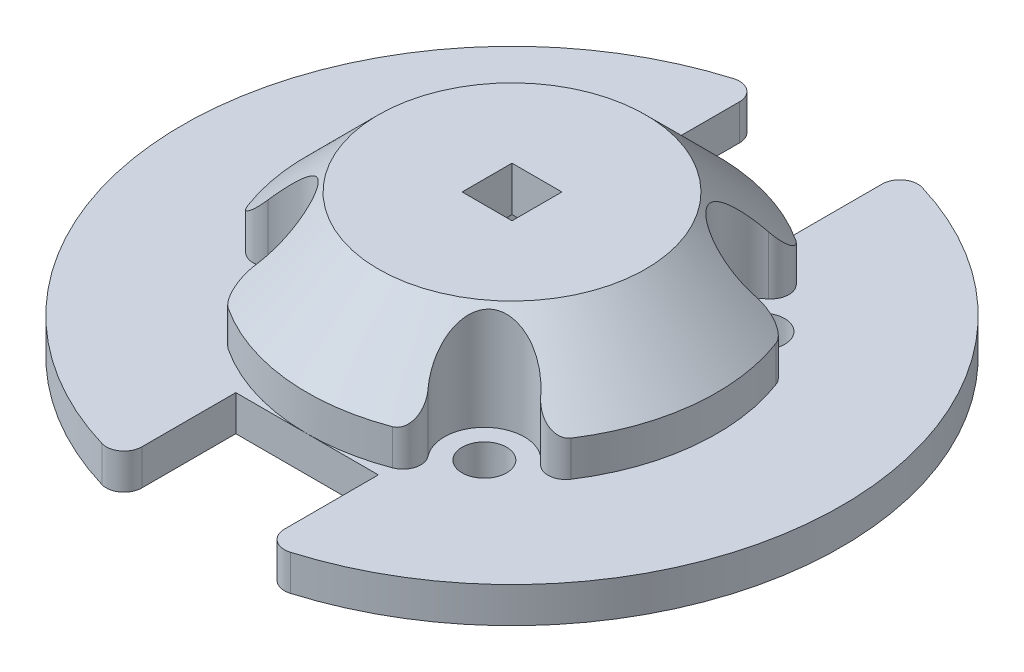
from build123d import *

# Parameters (mm, degrees)
SKETCH1_R             = 12.5
BOSS_EXTRUDE1_DEPTH   = 2
SKETCH2_R             = 11.5
BOSS_EXTRUDE2_DEPTH   = 6
F_2_5MM_DOWEL_HOLE1_D = 2.5
SKETCH7_R             = 2.25
CUT_EXTRUDE1_DEPTH    = 15
CIRPATTERN1_COUNT     = 4
SKETCH8_R             = 7.7
CUT_EXTRUDE2_DEPTH    = 3.5
CHAMFER4_SIZE         = 4
SKETCH3_W             = 2.8
SKETCH3_H             = 2.8
CUT_EXTRUDE3_DEPTH    = 20.403607912
SKETCH9_R             = 5
CUT_EXTRUDE4_DEPTH    = 2
FILLET1_R             = 1
SKETCH11_W            = 6
SKETCH11_H            = 2
SKETCH13_W            = 8
SKETCH13_H            = 10.327587527
CUT_EXTRUDE5_DEPTH    = 10
FILLET2_R             = 1


with BuildPart() as part:
    # Sketch1 → Boss-Extrude1 (new body)
    with BuildSketch(Plane(origin=(0, 0, 0), x_dir=(1, 0, 0), z_dir=(0, 1, 0))):
        with Locations(Location((0, 0, 0), (0, 0, 270))):
            Circle(SKETCH1_R)
    extrude(amount=BOSS_EXTRUDE1_DEPTH)

    # Sketch2 → Boss-Extrude2 (add)
    with BuildSketch(Plane(origin=(0, 2, 0), x_dir=(1, 0, 0), z_dir=(0, 1, 0))):
        with Locations(Location((0, 0, 0), (0, 0, 270))):
            Circle(SKETCH2_R)
    extrude(amount=BOSS_EXTRUDE2_DEPTH)

    # Ø2.5mm Dowel Hole1 (through all)
    with Locations(Plane(origin=(0, 0, 0), x_dir=(-1, 0, 0), z_dir=(0, -1, 0))):
        with Locations((-6.252229289, -7.804462116)):
            f_2_5mm_dowel_hole1 = Hole(F_2_5MM_DOWEL_HOLE1_D / 2)

    # Sketch7 → Cut-Extrude1 (cut)
    with BuildSketch(Plane(origin=(0, 2, 0), x_dir=(1, 0, 0), z_dir=(0, 1, 0))):
        with Locations((6.252229289, -7.804462116)):
            Circle(SKETCH7_R)
    cut_extrude1 = extrude(amount=CUT_EXTRUDE1_DEPTH, mode=Mode.SUBTRACT)

    # CirPattern1: Ø2.5mm Dowel Hole1, Cut-Extrude1 ×4 about axis
    cirpattern1_axis = Axis((0, 0, 0), (0, 1, 0))
    add([f_2_5mm_dowel_hole1.rotate(cirpattern1_axis, i * 360 / CIRPATTERN1_COUNT) for i in range(1, CIRPATTERN1_COUNT)], mode=Mode.SUBTRACT)
    add([cut_extrude1.rotate(cirpattern1_axis, i * 360 / CIRPATTERN1_COUNT) for i in range(1, CIRPATTERN1_COUNT)], mode=Mode.SUBTRACT)

    # Sketch8 → Cut-Extrude2 (cut)
    with BuildSketch(Plane.XZ):
        with Locations(Location((0, 0, 0), (0, 0, 270))):
            Circle(SKETCH8_R)
    extrude(amount=-CUT_EXTRUDE2_DEPTH, mode=Mode.SUBTRACT)

    # Chamfer4
    # the kernel refuses this chamfer: 4 mm, written as the material it takes off along each edge
    with BuildSketch(Plane(origin=(0, 8, 0), x_dir=(-0.15654942512802536, 0, 0.9876701258477371), z_dir=(0.9876701258477371, 0, 0.15654942512802536))) as chamfer4_piece_1:
        Polygon((11.5, CHAMFER4_SIZE), (11.5 - CHAMFER4_SIZE, 0), (11.5, 0), align=None)
    revolve(axis=Axis((0, 8, 0), (0, -1, 0)), revolution_arc=174.589558781, mode=Mode.SUBTRACT)
    with BuildSketch(Plane(origin=(0, 8, 0), x_dir=(0.9876701258477374, 0, 0.15654942512802353), z_dir=(0.15654942512802353, 0, -0.9876701258477374))) as chamfer4_piece_2:
        Polygon((11.5, CHAMFER4_SIZE), (11.5 - CHAMFER4_SIZE, 0), (11.5, 0), align=None)
    revolve(axis=Axis((0, 8, 0), (0, -1, 0)), revolution_arc=174.589558781, mode=Mode.SUBTRACT)
    with BuildSketch(Plane(origin=(0, 8, 0), x_dir=(-0.9876701258477374, 0, -0.15654942512802342), z_dir=(-0.15654942512802342, 0, 0.9876701258477374))) as chamfer4_piece_3:
        Polygon((11.5, CHAMFER4_SIZE), (11.5 - CHAMFER4_SIZE, 0), (11.5, 0), align=None)
    revolve(axis=Axis((0, 8, 0), (0, -1, 0)), revolution_arc=174.589558781, mode=Mode.SUBTRACT)
    with BuildSketch(Plane(origin=(0, 8, 0), x_dir=(0.15654942512802555, 0, -0.987670125847737), z_dir=(-0.987670125847737, 0, -0.15654942512802555))) as chamfer4_piece_4:
        Polygon((11.5, CHAMFER4_SIZE), (11.5 - CHAMFER4_SIZE, 0), (11.5, 0), align=None)
    revolve(axis=Axis((0, 8, 0), (0, -1, 0)), revolution_arc=174.589558781, mode=Mode.SUBTRACT)

    # Sketch3 → Cut-Extrude3 (cut, through all)
    with BuildSketch(Plane(origin=(0, 8, 0), x_dir=(1, 0, 0), z_dir=(0, 1, 0))):
        Rectangle(SKETCH3_W, SKETCH3_H)
    extrude(amount=-CUT_EXTRUDE3_DEPTH, mode=Mode.SUBTRACT)

    # Sketch9 → Cut-Extrude4 (cut)
    with BuildSketch(Plane.XZ.offset(-3.5)):
        with Locations(Location((0, 0, 0), (0, 0, 270))):
            Circle(SKETCH9_R)
    extrude(amount=-CUT_EXTRUDE4_DEPTH, mode=Mode.SUBTRACT)

    # Fillet1
    # the kernel refuses this fillet: 1 mm, written as the material it takes off along each edge
    with BuildSketch(Plane(origin=(-7.744399955, 8.541870217, 8.501427488), x_dir=(0.7901380360957252, 0, 0.6129289387154032), z_dir=(0, -1, 0)), Plane(origin=(-8.501427488, 8.541870217, -7.744399955), x_dir=(-0.6129289387154034, 0, 0.790138036095725), z_dir=(0, -1, 0)), Plane(origin=(8.501427488, 8.541870217, 7.744399955), x_dir=(0.6129289387154006, 0, -0.7901380360957272), z_dir=(0, -1, 0))) as fillet1_piece_1:
        with BuildLine():
            CenterArc((1.73775904, -0.996875484), FILLET1_R, 85.469541484, 107.754858312)
            ThreePointArc((0.76427747, -1.225640938), (0.48316298, -0.549824406), (0, 0))
            ThreePointArc((0, 0), (0.908374043, 0.035931935), (1.816748087, 0))
        make_face()
    extrude(amount=6.541870217, mode=Mode.SUBTRACT)
    with BuildSketch(Plane(origin=(-9.986362414, 8.541870217, 5.702855929), x_dir=(0.5425108766100752, 0, -0.840048777607448), z_dir=(0, -1, 0)), Plane(origin=(-5.702855929, 8.541870217, -9.986362414), x_dir=(0.8400487776074425, 0, 0.5425108766100841), z_dir=(0, -1, 0)), Plane(origin=(9.986362414, 8.541870217, -5.702855929), x_dir=(-0.5425108766100888, 0, 0.8400487776074392), z_dir=(0, -1, 0)), Plane(origin=(5.702855929, 8.541870217, 9.986362414), x_dir=(-0.8400487776074446, 0, -0.5425108766100806), z_dir=(0, -1, 0))) as fillet1_piece_2:
        with BuildLine():
            CenterArc((1.765388102, -0.94708609), FILLET1_R, 108.722180598, 107.754858312)
            ThreePointArc((0.961292932, -1.541586686), (0.450156717, -0.789805949), (0, 0))
            ThreePointArc((0, 0), (0.722204223, -0.119056298), (1.444408447, 0))
        make_face()
    extrude(amount=6.541870217, mode=Mode.SUBTRACT)
    with BuildSketch(Plane(origin=(7.744399955, 8.541870217, -8.501427488), x_dir=(-0.9381802645731545, 0, 0.34614706580505045), z_dir=(0, -1, 0))) as fillet1_piece_3:
        with BuildLine():
            CenterArc((1.765388102, 0.94708609), FILLET1_R, 143.52296109, 107.754858312)
            ThreePointArc((0.961292932, 1.541586686), (0.450156717, 0.789805949), (0, 0))
            ThreePointArc((0, 0), (0.722204223, 0.119056298), (1.444408447, 0))
        make_face()
    extrude(amount=6.541870217, mode=Mode.SUBTRACT)

    # Sketch11 → Revolve1 (revolve)
    with BuildSketch(Plane(origin=(0, 0, 0), x_dir=(0, 0, -1), z_dir=(1, 0, 0)), mode=Mode.PRIVATE) as revolve1_sk:
        with Locations((15.5, 1)):
            Rectangle(SKETCH11_W, SKETCH11_H)
    revolve(revolve1_sk.sketch.rotate(Axis((0, 0, 0), (0, 1, 0)), 20.668231864), axis=Axis((0, 0, 0), (0, 1, 0)))

    # Sketch13 → Cut-Extrude5 (cut)
    with BuildSketch(Plane(origin=(0, 2, 0), x_dir=(1, 0, 0), z_dir=(0, 1, 0))):
        with Locations((0, 16.663793764)):
            Rectangle(SKETCH13_W, SKETCH13_H)
        with Locations((0, -16.663793764)):
            Rectangle(SKETCH13_W, SKETCH13_H)
    extrude(amount=-CUT_EXTRUDE5_DEPTH, mode=Mode.SUBTRACT)

    # Fillet2
    fillet2_edges = [part.edges().sort_by_distance(p)[0] for p in [
        (-4, 1, -18.062391868),
        (4, 1, -18.062391868),
        (4, 1, 18.062391868),
        (-4, 1, 18.062391868),
    ]]
    fillet(fillet2_edges, radius=FILLET2_R)


solid = part.part
